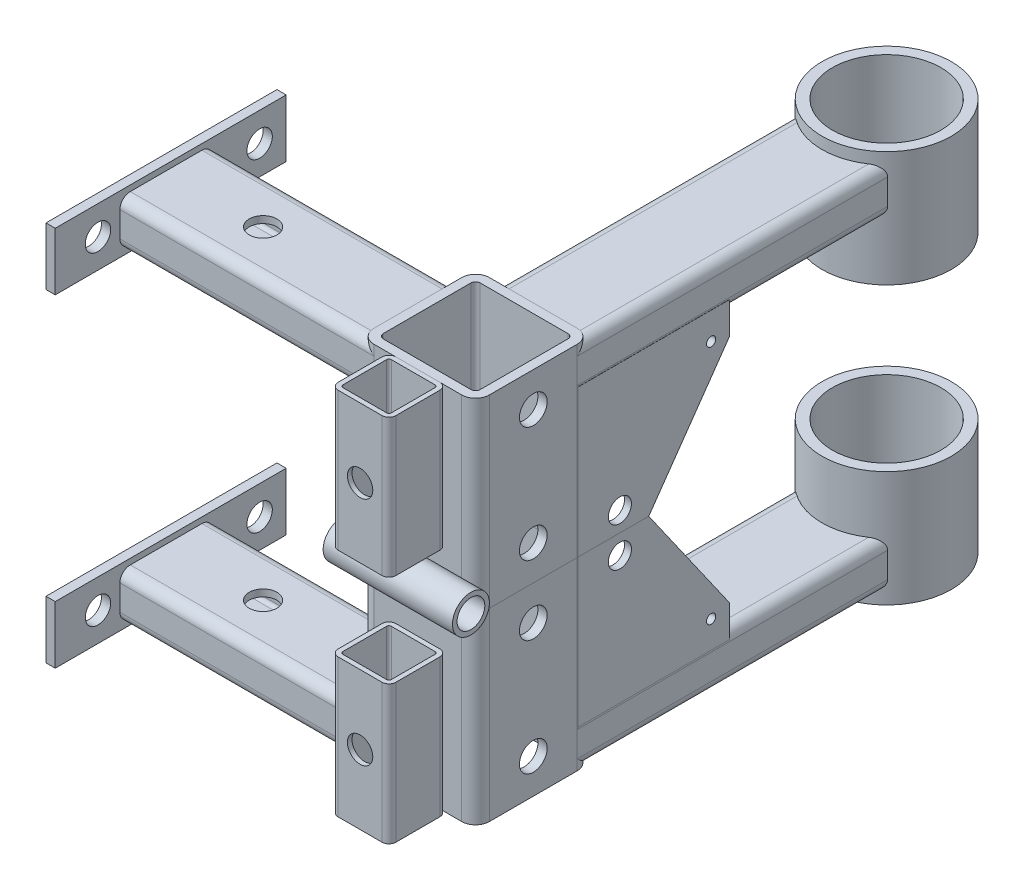
from build123d import *

# Parameters (mm, degrees)
AXBXS_8645_68_40_X_20_X_3_1_DEPTH        = 173.360679775
AXBXS_8645_68_40_X_20_X_3_1_2_DEPTH      = 134
AXBXS_8645_68_40_X_20_X_3_1_2_DEPTH_BACK = 23.360679775
BXBXS_8639_82_50_X_50_X_4_2_DEPTH        = 10
BXBXS_8639_82_50_X_50_X_4_2_2_DEPTH      = 70
WELD_START                               = -10
WELD_TRIM_1_DEPTH                        = 20
WELD_TRIM_1_2_DEPTH                      = 20
EXTRUDE_1_DEPTH                          = 5
EXTRUDE_1_DEPTH_BACK                     = 45
SKETCH_8_R                               = 28
SKETCH_8_R_2                             = 23.5
MOVE_FACE_1_BY                           = 10.151380586
CUT_EXTRUDE_1_DEPTH                      = 261.032690304
CUT_EXTRUDE_1_DEPTH_BACK                 = 261.032690304
SKETCH_10_R                              = 23.5
SKETCH_11_W                              = 100
SKETCH_11_H                              = 25
EXTRUDE_2_DEPTH                          = 4
SKETCH_12_R                              = 5.5
CUT_EXTRUDE_2_DEPTH                      = 4
BXBXS_8639_82_25_X_25_X_2_1_DEPTH        = 60
SKETCH_15_R                              = 5.5
CUT_EXTRUDE_3_DEPTH                      = 2
SKETCH_16_R                              = 2
SKETCH_16_R_2                            = 5
EXTRUDE_3_DEPTH                          = 3
MOVE_FACE_2_BY                           = 5.566590861
MOVE_FACE_3_BY                           = 3.765270811
SKETCH_18_R                              = 6
CUT_EXTRUDE_6_DEPTH                      = 4
SKETCH_19_R                              = 6
CUT_EXTRUDE_7_DEPTH                      = 256.107820343
SKETCH_21_R                              = 8
SKETCH_21_R_2                            = 6
EXTRUDE_4_DEPTH                          = 56


# Read off the part's stored shape, not the designer's step: Отсечь/Удлинить1
with BuildPart() as part:
    # Sketch1 on segment 1 (carried to segment 1) → Труба axbxs гост8645-68 40 X 20 X 3(1) (new body)
    with BuildSketch(Plane(origin=(0, 0, -150), x_dir=(0, 1, 0), z_dir=(0, 0, 1))):
        with BuildLine():
            Line((-5.5, -20), (5.5, -20))
            ThreePointArc((5.5, -20), (8.681980515, -18.681980515), (10, -15.5))
            Line((10, -15.5), (10, 15.5))
            ThreePointArc((10, 15.5), (8.681980515, 18.681980515), (5.5, 20))
            Line((5.5, 20), (-5.5, 20))
            ThreePointArc((-5.5, 20), (-8.681980515, 18.681980515), (-10, 15.5))
            Line((-10, 15.5), (-10, -15.5))
            ThreePointArc((-10, -15.5), (-8.681980515, -18.681980515), (-5.5, -20))
        make_face()
        with BuildLine():
            Line((-5.5, -17), (5.5, -17))
            ThreePointArc((5.5, -17), (6.560660172, -16.560660172), (7, -15.5))
            Line((7, -15.5), (7, 15.5))
            ThreePointArc((7, 15.5), (6.560660172, 16.560660172), (5.5, 17))
            Line((5.5, 17), (-5.5, 17))
            ThreePointArc((-5.5, 17), (-6.560660172, 16.560660172), (-7, 15.5))
            Line((-7, 15.5), (-7, -15.5))
            ThreePointArc((-7, -15.5), (-6.560660172, -16.560660172), (-5.5, -17))
        make_face(mode=Mode.SUBTRACT)
    extrude(amount=AXBXS_8645_68_40_X_20_X_3_1_DEPTH)

    # Труба axbxs гост8645-68 40 X 20 X 3(1) mitre 1
    split(bisect_by=Plane(origin=(0, 0, 0), x_dir=(0, 1, 0), z_dir=(0.707106781, 0, -0.707106781)), keep=Keep.TOP)

    # Weld Trim 1 2 outline → Weld Trim 1 2 (cut)
    with BuildSketch(Plane(origin=(0, 0, 0), x_dir=(1, 0, 0), z_dir=(0, 1, 0)).offset(WELD_START)):
        with BuildLine():
            Line((14, 30), (-20, 30))
            Line((-20, 30), (-20, 20))
            Line((-20, 20), (20, -20))
            Line((20, -20), (20, 24))
            ThreePointArc((20, 24), (18.242640687, 28.242640687), (14, 30))
        make_face()
    extrude(amount=WELD_TRIM_1_2_DEPTH, mode=Mode.SUBTRACT)

    # Move Face 1: a face moved outward by 10.151381
    extrude(part.faces().sort_by_distance((0, -8, -150))[0], amount=MOVE_FACE_1_BY, dir=(0, 0, -1))

    # Эскиз10 → Вырез-Вытянуть1 (cut, two sides: drawn at the far end of the back side and taken through both)
    with BuildSketch(Plane.XZ.offset(15).offset(-CUT_EXTRUDE_1_DEPTH_BACK)):
        with Locations((0, -178)):
            Circle(SKETCH_10_R)
    extrude(amount=CUT_EXTRUDE_1_DEPTH + CUT_EXTRUDE_1_DEPTH_BACK, mode=Mode.SUBTRACT)


with BuildPart() as body_2:
    # Sketch1 → axbxs _8645-68 40 X 20 X 3_1 2 (new, two sides: drawn at the far end of the back side and taken through both)
    with BuildSketch(Plane(origin=(0, 0, 0), x_dir=(0, 1, 0), z_dir=(-1, 0, 0)).offset(-AXBXS_8645_68_40_X_20_X_3_1_2_DEPTH_BACK)):
        with BuildLine():
            Line((-5.5, -20), (5.5, -20))
            ThreePointArc((5.5, -20), (8.681980515, -18.681980515), (10, -15.5))
            Line((10, -15.5), (10, 15.5))
            ThreePointArc((10, 15.5), (8.681980515, 18.681980515), (5.5, 20))
            Line((5.5, 20), (-5.5, 20))
            ThreePointArc((-5.5, 20), (-8.681980515, 18.681980515), (-10, 15.5))
            Line((-10, 15.5), (-10, -15.5))
            ThreePointArc((-10, -15.5), (-8.681980515, -18.681980515), (-5.5, -20))
        make_face()
        with BuildLine():
            Line((-5.5, -17), (5.5, -17))
            ThreePointArc((5.5, -17), (6.560660172, -16.560660172), (7, -15.5))
            Line((7, -15.5), (7, 15.5))
            ThreePointArc((7, 15.5), (6.560660172, 16.560660172), (5.5, 17))
            Line((5.5, 17), (-5.5, 17))
            ThreePointArc((-5.5, 17), (-6.560660172, 16.560660172), (-7, 15.5))
            Line((-7, 15.5), (-7, -15.5))
            ThreePointArc((-7, -15.5), (-6.560660172, -16.560660172), (-5.5, -17))
        make_face(mode=Mode.SUBTRACT)
    extrude(amount=AXBXS_8645_68_40_X_20_X_3_1_2_DEPTH + AXBXS_8645_68_40_X_20_X_3_1_2_DEPTH_BACK)

    # axbxs _8645-68 40 X 20 X 3_1 2 mitre 1
    split(bisect_by=Plane(origin=(0, 0, 0), x_dir=(0, -1, 0), z_dir=(-0.707106781, 0, 0.707106781)), keep=Keep.TOP)

    # Weld Trim 1 outline → Weld Trim 1 (cut)
    with BuildSketch(Plane(origin=(0, 0, 0), x_dir=(1, 0, 0), z_dir=(0, 1, 0)).offset(WELD_START)):
        with BuildLine():
            ThreePointArc((-30, -14), (-28.242640687, -18.242640687), (-24, -20))
            Line((-24, -20), (20, -20))
            Line((20, -20), (-20, 20))
            Line((-20, 20), (-30, 20))
            Line((-30, 20), (-30, -14))
        make_face()
    extrude(amount=WELD_TRIM_1_DEPTH, mode=Mode.SUBTRACT)

    # Эскиз19 → Вырез-Вытянуть7 (cut, through all)
    with BuildSketch(Plane(origin=(0, 10, 0), x_dir=(1, 0, 0), z_dir=(0, 1, 0))):
        with Locations(Location((-92, 0, 0), (0, 0, 270))):
            Circle(SKETCH_19_R)
    extrude(amount=-CUT_EXTRUDE_7_DEPTH, mode=Mode.SUBTRACT)


with BuildPart() as body_3:
    # Sketch14 → Труба bxbxs гост8639-82 50 X 50 X 4(2) (new body)
    with BuildSketch(Plane(origin=(-5, 0, -5), x_dir=(1, 0, 0), z_dir=(0, 1, 0))):
        with BuildLine():
            Line((-19, -25), (19, -25))
            ThreePointArc((19, -25), (23.242640687, -23.242640687), (25, -19))
            Line((25, -19), (25, 19))
            ThreePointArc((25, 19), (23.242640687, 23.242640687), (19, 25))
            Line((19, 25), (-19, 25))
            ThreePointArc((-19, 25), (-23.242640687, 23.242640687), (-25, 19))
            Line((-25, 19), (-25, -19))
            ThreePointArc((-25, -19), (-23.242640687, -23.242640687), (-19, -25))
        make_face()
        with BuildLine():
            Line((-19, -21), (19, -21))
            ThreePointArc((19, -21), (20.414213562, -20.414213562), (21, -19))
            Line((21, -19), (21, 19))
            ThreePointArc((21, 19), (20.414213562, 20.414213562), (19, 21))
            Line((19, 21), (-19, 21))
            ThreePointArc((-19, 21), (-20.414213562, 20.414213562), (-21, 19))
            Line((-21, 19), (-21, -19))
            ThreePointArc((-21, -19), (-20.414213562, -20.414213562), (-19, -21))
        make_face(mode=Mode.SUBTRACT)
    extrude(amount=-BXBXS_8639_82_50_X_50_X_4_2_DEPTH)


with BuildPart() as body_4:
    # Sketch14 on segment 2 (carried to segment 2) → bxbxs _8639-82 50 X 50 X 4_2 2 (new body)
    with BuildSketch(Plane(origin=(-5, 0, -5), x_dir=(1, 0, 0), z_dir=(0, 1, 0))):
        with BuildLine():
            Line((-19, -25), (19, -25))
            ThreePointArc((19, -25), (23.242640687, -23.242640687), (25, -19))
            Line((25, -19), (25, 19))
            ThreePointArc((25, 19), (23.242640687, 23.242640687), (19, 25))
            Line((19, 25), (-19, 25))
            ThreePointArc((-19, 25), (-23.242640687, 23.242640687), (-25, 19))
            Line((-25, 19), (-25, -19))
            ThreePointArc((-25, -19), (-23.242640687, -23.242640687), (-19, -25))
        make_face()
        with BuildLine():
            Line((-19, -21), (19, -21))
            ThreePointArc((19, -21), (20.414213562, -20.414213562), (21, -19))
            Line((21, -19), (21, 19))
            ThreePointArc((21, 19), (20.414213562, 20.414213562), (19, 21))
            Line((19, 21), (-19, 21))
            ThreePointArc((-19, 21), (-20.414213562, 20.414213562), (-21, 19))
            Line((-21, 19), (-21, -19))
            ThreePointArc((-21, -19), (-20.414213562, -20.414213562), (-19, -21))
        make_face(mode=Mode.SUBTRACT)
    extrude(amount=BXBXS_8639_82_50_X_50_X_4_2_2_DEPTH)


with BuildPart() as body_5:
    # Эскиз8 → Бобышка-Вытянуть1 (new, two sides: drawn at the far end of the back side and taken through both)
    with BuildSketch(Plane.XZ.offset(10).offset(-EXTRUDE_1_DEPTH_BACK)):
        with Locations((0, -178)):
            Circle(SKETCH_8_R)
        with Locations((0, -178)):
            Circle(SKETCH_8_R_2, mode=Mode.SUBTRACT)
    extrude(amount=EXTRUDE_1_DEPTH + EXTRUDE_1_DEPTH_BACK)


with BuildPart() as body_6:
    # Эскиз11 → Бобышка-Вытянуть2 (new body)
    with BuildSketch(Plane.ZY.offset(134)):
        with Locations((-2, 0)):
            Rectangle(SKETCH_11_W, SKETCH_11_H)
    extrude(amount=EXTRUDE_2_DEPTH)

    # Эскиз12 → Вырез-Вытянуть2 (cut)
    with BuildSketch(Plane.ZY.offset(138)):
        with Locations((-40.5, 0)):
            Circle(SKETCH_12_R)
        with Locations((29.5, 0)):
            Circle(SKETCH_12_R)
    extrude(amount=-CUT_EXTRUDE_2_DEPTH, mode=Mode.SUBTRACT)


with BuildPart() as body_7:
    # Sketch15 → Труба bxbxs гост8639-82 25 X 25 X 2(1) (new body)
    with BuildSketch(Plane(origin=(-5, -10, 32.5), x_dir=(1, 0, 0), z_dir=(0, 1, 0))):
        with BuildLine():
            Line((-9.5, -12.5), (9.5, -12.5))
            ThreePointArc((9.5, -12.5), (11.621320344, -11.621320344), (12.5, -9.5))
            Line((12.5, -9.5), (12.5, 9.5))
            ThreePointArc((12.5, 9.5), (11.621320344, 11.621320344), (9.5, 12.5))
            Line((9.5, 12.5), (-9.5, 12.5))
            ThreePointArc((-9.5, 12.5), (-11.621320344, 11.621320344), (-12.5, 9.5))
            Line((-12.5, 9.5), (-12.5, -9.5))
            ThreePointArc((-12.5, -9.5), (-11.621320344, -11.621320344), (-9.5, -12.5))
        make_face()
        with BuildLine():
            Line((-9.5, -10.5), (9.5, -10.5))
            ThreePointArc((9.5, -10.5), (10.207106781, -10.207106781), (10.5, -9.5))
            Line((10.5, -9.5), (10.5, 9.5))
            ThreePointArc((10.5, 9.5), (10.207106781, 10.207106781), (9.5, 10.5))
            Line((9.5, 10.5), (-9.5, 10.5))
            ThreePointArc((-9.5, 10.5), (-10.207106781, 10.207106781), (-10.5, 9.5))
            Line((-10.5, 9.5), (-10.5, -9.5))
            ThreePointArc((-10.5, -9.5), (-10.207106781, -10.207106781), (-9.5, -10.5))
        make_face(mode=Mode.SUBTRACT)
    extrude(amount=BXBXS_8639_82_25_X_25_X_2_1_DEPTH)

    # Эскиз15 → Вырез-Вытянуть3 (cut)
    with BuildSketch(Plane.XY.offset(45)):
        with Locations((-5, 20)):
            Circle(SKETCH_15_R)
    extrude(amount=-CUT_EXTRUDE_3_DEPTH, mode=Mode.SUBTRACT)


with BuildPart() as body_8:
    # Эскиз16 → Бобышка-Вытянуть3 (new body)
    with BuildSketch(Plane(origin=(20, 0, 0), x_dir=(0, 0, -1), z_dir=(1, 0, 0))):
        Polygon((30, 10), (30, 70), (55, 70), (90, 20), (90, 10), align=None)
        with Locations((82, 18)):
            Circle(SKETCH_16_R, mode=Mode.SUBTRACT)
        with Locations((42.5, 61.5)):
            Circle(SKETCH_16_R_2, mode=Mode.SUBTRACT)
    extrude(amount=-EXTRUDE_3_DEPTH)

    # Move Face 2: a face moved outward by 5.566591
    extrude(body_8.faces().sort_by_distance((18.5, 40, -30))[0], amount=MOVE_FACE_2_BY, dir=(0, 0, 1))

    # Move Face 3: a face moved outward by 3.765271
    extrude(body_8.faces().sort_by_distance((18.5, 10, -57.21670457))[0], amount=MOVE_FACE_3_BY, dir=(0, -1, 0))


with BuildPart() as body_3_1:
    add(body_3.part)

    # Combine 1: union body 4
    add(body_4.part)

    # Эскиз18 → Вырез-Вытянуть6 (cut)
    with BuildSketch(Plane(origin=(20, 0, 0), x_dir=(0, 0, -1), z_dir=(1, 0, 0))):
        with Locations((5, 55)):
            Circle(SKETCH_18_R)
        with Locations((5, 5)):
            Circle(SKETCH_18_R)
    extrude(amount=-CUT_EXTRUDE_6_DEPTH, mode=Mode.SUBTRACT)


with BuildPart() as body_8_2:
    # Зеркальное отражение1: mirrored copy
    add(body_7.part.mirror(Plane(origin=(14, 70, -24), x_dir=(0, 0, 1), z_dir=(0, 1, 0))))


with BuildPart() as body_9:
    # Mirror 1 2: mirrored copy
    add(body_2.part.mirror(Plane(origin=(14, 70, -24), x_dir=(0, 0, 1), z_dir=(0, 1, 0))))


with BuildPart() as body_10:
    # Mirror 1 3: mirrored copy
    add(body_6.part.mirror(Plane(origin=(14, 70, -24), x_dir=(0, 0, 1), z_dir=(0, 1, 0))))


with BuildPart() as body_11:
    # Mirror 1 4: mirrored copy
    add(body_8.part.mirror(Plane(origin=(14, 70, -24), x_dir=(0, 0, 1), z_dir=(0, 1, 0))))


with BuildPart() as body_12:
    # Mirror 1 5: mirrored copy
    add(part.part.mirror(Plane(origin=(14, 70, -24), x_dir=(0, 0, 1), z_dir=(0, 1, 0))))


with BuildPart() as body_13:
    # Mirror 1 6: mirrored copy
    add(body_5.part.mirror(Plane(origin=(14, 70, -24), x_dir=(0, 0, 1), z_dir=(0, 1, 0))))


with BuildPart() as body_14:
    # Mirror 1 7: mirrored copy
    add(body_3_1.part.mirror(Plane(origin=(14, 70, -24), x_dir=(0, 0, 1), z_dir=(0, 1, 0))))


with BuildPart() as body_15:
    # Эскиз21 → Бобышка-Вытянуть4 (new body)
    with BuildSketch(Plane.ZY.offset(30)):
        with Locations((28, 78)):
            Circle(SKETCH_21_R)
        with Locations((28, 78)):
            Circle(SKETCH_21_R_2, mode=Mode.SUBTRACT)
    extrude(amount=-EXTRUDE_4_DEPTH)


solid = Compound([part.part, body_2.part, body_5.part, body_6.part, body_7.part, body_8.part, body_3_1.part, body_8_2.part, body_9.part, body_10.part, body_11.part, body_12.part, body_13.part, body_14.part, body_15.part])
